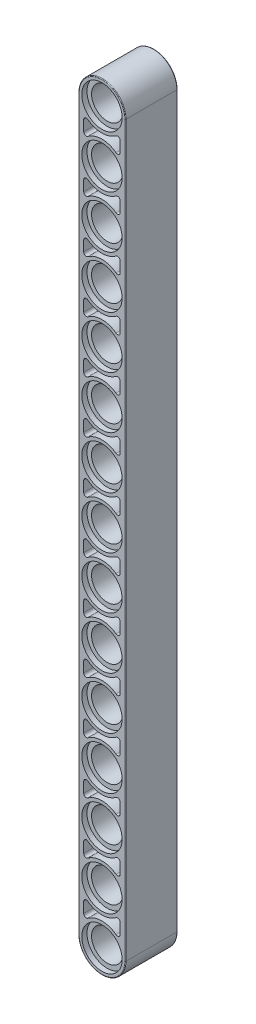
from build123d import *

# Parameters (mm, degrees)
BOSS_EXTRUDE1_DEPTH   = 8
CUT_EXTRUDE1_DEPTH    = 3.1
CUT_EXTRUDE2_DEPTH    = 3.1
CUT_EXTRUDE3_DEPTH    = 3.1
CUT_EXTRUDE4_DEPTH    = 3.1
CUT_EXTRUDE5_DEPTH    = 3.1
CUT_EXTRUDE6_DEPTH    = 3.1
CUT_EXTRUDE7_DEPTH    = 3.1
CUT_EXTRUDE8_DEPTH    = 3.1
CUT_EXTRUDE9_START    = -3.1
CUT_EXTRUDE9_DEPTH    = 3.1
CUT_EXTRUDE10_START   = -3.1
CUT_EXTRUDE10_DEPTH   = 3.1
CUT_EXTRUDE11_START   = -3.1
CUT_EXTRUDE11_DEPTH   = 3.1
CUT_EXTRUDE12_START   = -3.1
CUT_EXTRUDE12_DEPTH   = 3.1
CUT_EXTRUDE13_START   = -3.1
CUT_EXTRUDE13_DEPTH   = 3.1
CUT_EXTRUDE14_START   = -3.1
CUT_EXTRUDE14_DEPTH   = 3.1
CUT_EXTRUDE15_START   = -3.1
CUT_EXTRUDE15_DEPTH   = 3.1
CUT_EXTRUDE16_START   = -3.1
CUT_EXTRUDE16_DEPTH   = 3.1
FILLET1_R             = 0.1
LPATTERN1_COUNT       = 4
LPATTERN1_PITCH       = 8
LPATTERN1_COUNT_DIR2  = 12
LPATTERN1_PITCH_DIR2  = 8
LPATTERN2_COUNT       = 9
LPATTERN2_PITCH       = 8
LPATTERN2_COUNT_DIR2  = 6
LPATTERN2_PITCH_DIR2  = 8
MIRROR1_COPY_1_DEPTH  = 3.1
MIRROR1_COPY_2_DEPTH  = 3.1
MIRROR1_COPY_3_DEPTH  = 3.1
MIRROR1_COPY_4_DEPTH  = 3.1
MIRROR1_COPY_5_DEPTH  = 3.1
MIRROR1_COPY_6_DEPTH  = 3.1
MIRROR1_COPY_7_DEPTH  = 3.1
MIRROR1_COPY_8_DEPTH  = 3.1
MIRROR1_COPY_9_DEPTH  = 3.1
MIRROR1_COPY_10_DEPTH = 3.1
MIRROR1_COPY_11_DEPTH = 3.1
MIRROR1_COPY_12_DEPTH = 3.1
MIRROR1_COPY_13_DEPTH = 3.1
MIRROR1_COPY_14_DEPTH = 3.1
MIRROR1_COPY_15_DEPTH = 3.1
MIRROR1_COPY_16_DEPTH = 3.1
MIRROR1_COPY_17_DEPTH = 3.1
MIRROR1_COPY_18_DEPTH = 3.1
MIRROR1_COPY_19_DEPTH = 3.1
MIRROR1_COPY_20_DEPTH = 3.1
MIRROR1_COPY_21_DEPTH = 3.1
MIRROR1_COPY_22_DEPTH = 3.1
MIRROR1_COPY_23_DEPTH = 3.1
MIRROR1_COPY_24_DEPTH = 3.1
MIRROR1_COPY_25_DEPTH = 3.1
MIRROR1_COPY_26_DEPTH = 3.1
MIRROR1_COPY_27_DEPTH = 3.1
MIRROR1_COPY_28_DEPTH = 3.1
MIRROR1_COPY_29_DEPTH = 3.1
MIRROR1_COPY_30_DEPTH = 3.1
MIRROR1_COPY_31_DEPTH = 3.1
MIRROR1_COPY_32_DEPTH = 3.1
MIRROR1_COPY_33_DEPTH = 3.1
MIRROR1_COPY_34_DEPTH = 3.1
MIRROR1_COPY_35_DEPTH = 3.1
MIRROR1_COPY_36_DEPTH = 3.1
MIRROR1_COPY_37_DEPTH = 3.1
MIRROR1_COPY_38_DEPTH = 3.1
MIRROR1_COPY_39_DEPTH = 3.1
MIRROR1_COPY_40_DEPTH = 3.1
MIRROR1_COPY_41_DEPTH = 3.1
MIRROR1_COPY_42_DEPTH = 3.1
MIRROR1_COPY_43_DEPTH = 3.1
MIRROR1_COPY_44_DEPTH = 3.1
MIRROR1_COPY_45_DEPTH = 3.1
MIRROR1_COPY_46_DEPTH = 3.1
MIRROR1_COPY_47_DEPTH = 3.1
MIRROR1_COPY_48_DEPTH = 3.1
MIRROR1_COPY_49_DEPTH = 3.1
MIRROR1_COPY_50_DEPTH = 3.1
MIRROR1_COPY_51_DEPTH = 3.1
MIRROR1_COPY_52_DEPTH = 3.1
MIRROR1_COPY_53_DEPTH = 3.1
MIRROR1_COPY_54_DEPTH = 3.1


with BuildPart() as part:
    # Sketch1 → Boss-Extrude1 (new body)
    with BuildSketch(Plane.XY.offset(4)):
        with BuildLine():
            Line((3.6, -56), (3.6, 56))
            ThreePointArc((3.6, 56), (0, 59.6), (-3.6, 56))
            Line((-3.6, 56), (-3.6, -56))
            ThreePointArc((-3.6, -56), (0, -59.6), (3.6, -56))
        make_face()
    extrude(amount=-BOSS_EXTRUDE1_DEPTH)

    # Sketch2 → Cut-Extrude1 (cut)
    with BuildSketch(Plane.XY.offset(4)):
        with BuildLine():
            Line((-2.8, -27.2), (-2.8, -28.8))
            ThreePointArc((-2.8, -28.8), (-2.578885438, -29.157770876), (-2.16, -29.12))
            ThreePointArc((-2.16, -29.12), (0, -28.4), (2.16, -29.12))
            ThreePointArc((2.16, -29.12), (2.578885438, -29.157770876), (2.8, -28.8))
            Line((2.8, -28.8), (2.8, -27.2))
            ThreePointArc((2.8, -27.2), (2.578885438, -26.842229124), (2.16, -26.88))
            ThreePointArc((2.16, -26.88), (0, -27.6), (-2.16, -26.88))
            ThreePointArc((-2.16, -26.88), (-2.578885438, -26.842229124), (-2.8, -27.2))
        make_face()
    extrude(amount=-CUT_EXTRUDE1_DEPTH, mode=Mode.SUBTRACT)

    # Sketch3 → Cut-Extrude2 (cut)
    with BuildSketch(Plane.XY.offset(4)):
        with BuildLine():
            Line((-2.8, -11.2), (-2.8, -12.8))
            ThreePointArc((-2.8, -12.8), (-2.578885438, -13.157770876), (-2.16, -13.12))
            ThreePointArc((-2.16, -13.12), (0, -12.4), (2.16, -13.12))
            ThreePointArc((2.16, -13.12), (2.578885438, -13.157770876), (2.8, -12.8))
            Line((2.8, -12.8), (2.8, -11.2))
            ThreePointArc((2.8, -11.2), (2.578885438, -10.842229124), (2.16, -10.88))
            ThreePointArc((2.16, -10.88), (0, -11.6), (-2.16, -10.88))
            ThreePointArc((-2.16, -10.88), (-2.578885438, -10.842229124), (-2.8, -11.2))
        make_face()
    extrude(amount=-CUT_EXTRUDE2_DEPTH, mode=Mode.SUBTRACT)

    # Sketch4 → Cut-Extrude3 (cut)
    with BuildSketch(Plane.XY.offset(4)):
        with BuildLine():
            Line((-2.8, 4.8), (-2.8, 3.2))
            ThreePointArc((-2.8, 3.2), (-2.578885438, 2.842229124), (-2.16, 2.88))
            ThreePointArc((-2.16, 2.88), (0, 3.6), (2.16, 2.88))
            ThreePointArc((2.16, 2.88), (2.578885438, 2.842229124), (2.8, 3.2))
            Line((2.8, 3.2), (2.8, 4.8))
            ThreePointArc((2.8, 4.8), (2.578885438, 5.157770876), (2.16, 5.12))
            ThreePointArc((2.16, 5.12), (0, 4.4), (-2.16, 5.12))
            ThreePointArc((-2.16, 5.12), (-2.578885438, 5.157770876), (-2.8, 4.8))
        make_face()
    extrude(amount=-CUT_EXTRUDE3_DEPTH, mode=Mode.SUBTRACT)

    # Sketch5 → Cut-Extrude4 (cut)
    with BuildSketch(Plane.XY.offset(4)):
        with BuildLine():
            Line((-2.8, 20.8), (-2.8, 19.2))
            ThreePointArc((-2.8, 19.2), (-2.578885438, 18.842229124), (-2.16, 18.88))
            ThreePointArc((-2.16, 18.88), (0, 19.6), (2.16, 18.88))
            ThreePointArc((2.16, 18.88), (2.578885438, 18.842229124), (2.8, 19.2))
            Line((2.8, 19.2), (2.8, 20.8))
            ThreePointArc((2.8, 20.8), (2.578885438, 21.157770876), (2.16, 21.12))
            ThreePointArc((2.16, 21.12), (0, 20.4), (-2.16, 21.12))
            ThreePointArc((-2.16, 21.12), (-2.578885438, 21.157770876), (-2.8, 20.8))
        make_face()
    extrude(amount=-CUT_EXTRUDE4_DEPTH, mode=Mode.SUBTRACT)

    # Sketch6 → Cut-Extrude5 (cut)
    with BuildSketch(Plane.XY.offset(4)):
        with BuildLine():
            Line((2.8, 27.2), (2.8, 28.8))
            ThreePointArc((2.8, 28.8), (2.578885438, 29.157770876), (2.16, 29.12))
            ThreePointArc((2.16, 29.12), (0, 28.4), (-2.16, 29.12))
            ThreePointArc((-2.16, 29.12), (-2.578885438, 29.157770876), (-2.8, 28.8))
            Line((-2.8, 28.8), (-2.8, 27.2))
            ThreePointArc((-2.8, 27.2), (-2.578885438, 26.842229124), (-2.16, 26.88))
            ThreePointArc((-2.16, 26.88), (0, 27.6), (2.16, 26.88))
            ThreePointArc((2.16, 26.88), (2.578885438, 26.842229124), (2.8, 27.2))
        make_face()
    extrude(amount=-CUT_EXTRUDE5_DEPTH, mode=Mode.SUBTRACT)

    # Sketch7 → Cut-Extrude6 (cut)
    with BuildSketch(Plane.XY.offset(4)):
        with BuildLine():
            Line((-2.8, 12.8), (-2.8, 11.2))
            ThreePointArc((-2.8, 11.2), (-2.578885438, 10.842229124), (-2.16, 10.88))
            ThreePointArc((-2.16, 10.88), (0, 11.6), (2.16, 10.88))
            ThreePointArc((2.16, 10.88), (2.578885438, 10.842229124), (2.8, 11.2))
            Line((2.8, 11.2), (2.8, 12.8))
            ThreePointArc((2.8, 12.8), (2.578885438, 13.157770876), (2.16, 13.12))
            ThreePointArc((2.16, 13.12), (0, 12.4), (-2.16, 13.12))
            ThreePointArc((-2.16, 13.12), (-2.578885438, 13.157770876), (-2.8, 12.8))
        make_face()
    cut_extrude6 = extrude(amount=-CUT_EXTRUDE6_DEPTH, mode=Mode.SUBTRACT)

    # Sketch8 → Cut-Extrude7 (cut)
    with BuildSketch(Plane.XY.offset(4)):
        with BuildLine():
            Line((-2.8, -3.2), (-2.8, -4.8))
            ThreePointArc((-2.8, -4.8), (-2.578885438, -5.157770876), (-2.16, -5.12))
            ThreePointArc((-2.16, -5.12), (0, -4.4), (2.16, -5.12))
            ThreePointArc((2.16, -5.12), (2.578885438, -5.157770876), (2.8, -4.8))
            Line((2.8, -4.8), (2.8, -3.2))
            ThreePointArc((2.8, -3.2), (2.578885438, -2.842229124), (2.16, -2.88))
            ThreePointArc((2.16, -2.88), (0, -3.6), (-2.16, -2.88))
            ThreePointArc((-2.16, -2.88), (-2.578885438, -2.842229124), (-2.8, -3.2))
        make_face()
    extrude(amount=-CUT_EXTRUDE7_DEPTH, mode=Mode.SUBTRACT)

    # Sketch9 → Cut-Extrude8 (cut)
    with BuildSketch(Plane.XY.offset(4)):
        with BuildLine():
            Line((-2.8, -19.2), (-2.8, -20.8))
            ThreePointArc((-2.8, -20.8), (-2.578885438, -21.157770876), (-2.16, -21.12))
            ThreePointArc((-2.16, -21.12), (0, -20.4), (2.16, -21.12))
            ThreePointArc((2.16, -21.12), (2.578885438, -21.157770876), (2.8, -20.8))
            Line((2.8, -20.8), (2.8, -19.2))
            ThreePointArc((2.8, -19.2), (2.578885438, -18.842229124), (2.16, -18.88))
            ThreePointArc((2.16, -18.88), (0, -19.6), (-2.16, -18.88))
            ThreePointArc((-2.16, -18.88), (-2.578885438, -18.842229124), (-2.8, -19.2))
        make_face()
    extrude(amount=-CUT_EXTRUDE8_DEPTH, mode=Mode.SUBTRACT)

    # Sketch10 → Cut-Extrude9 (cut)
    with BuildSketch(Plane(origin=(0, 0, -4), x_dir=(-1, 0, 0), z_dir=(0, 0, -1)).offset(CUT_EXTRUDE9_START)):
        with BuildLine():
            Line((-2.8, -27.2), (-2.8, -28.8))
            ThreePointArc((-2.8, -28.8), (-2.578885438, -29.157770876), (-2.16, -29.12))
            ThreePointArc((-2.16, -29.12), (0, -28.4), (2.16, -29.12))
            ThreePointArc((2.16, -29.12), (2.578885438, -29.157770876), (2.8, -28.8))
            Line((2.8, -28.8), (2.8, -27.2))
            ThreePointArc((2.8, -27.2), (2.578885438, -26.842229124), (2.16, -26.88))
            ThreePointArc((2.16, -26.88), (0, -27.6), (-2.16, -26.88))
            ThreePointArc((-2.16, -26.88), (-2.578885438, -26.842229124), (-2.8, -27.2))
        make_face()
    extrude(amount=CUT_EXTRUDE9_DEPTH, mode=Mode.SUBTRACT)

    # Sketch11 → Cut-Extrude10 (cut)
    with BuildSketch(Plane(origin=(0, 0, -4), x_dir=(-1, 0, 0), z_dir=(0, 0, -1)).offset(CUT_EXTRUDE10_START)):
        with BuildLine():
            Line((-2.8, -19.2), (-2.8, -20.8))
            ThreePointArc((-2.8, -20.8), (-2.578885438, -21.157770876), (-2.16, -21.12))
            ThreePointArc((-2.16, -21.12), (0, -20.4), (2.16, -21.12))
            ThreePointArc((2.16, -21.12), (2.578885438, -21.157770876), (2.8, -20.8))
            Line((2.8, -20.8), (2.8, -19.2))
            ThreePointArc((2.8, -19.2), (2.578885438, -18.842229124), (2.16, -18.88))
            ThreePointArc((2.16, -18.88), (0, -19.6), (-2.16, -18.88))
            ThreePointArc((-2.16, -18.88), (-2.578885438, -18.842229124), (-2.8, -19.2))
        make_face()
    extrude(amount=CUT_EXTRUDE10_DEPTH, mode=Mode.SUBTRACT)

    # Sketch12 → Cut-Extrude11 (cut)
    with BuildSketch(Plane(origin=(0, 0, -4), x_dir=(-1, 0, 0), z_dir=(0, 0, -1)).offset(CUT_EXTRUDE11_START)):
        with BuildLine():
            Line((-2.8, -11.2), (-2.8, -12.8))
            ThreePointArc((-2.8, -12.8), (-2.578885438, -13.157770876), (-2.16, -13.12))
            ThreePointArc((-2.16, -13.12), (0, -12.4), (2.16, -13.12))
            ThreePointArc((2.16, -13.12), (2.578885438, -13.157770876), (2.8, -12.8))
            Line((2.8, -12.8), (2.8, -11.2))
            ThreePointArc((2.8, -11.2), (2.578885438, -10.842229124), (2.16, -10.88))
            ThreePointArc((2.16, -10.88), (0, -11.6), (-2.16, -10.88))
            ThreePointArc((-2.16, -10.88), (-2.578885438, -10.842229124), (-2.8, -11.2))
        make_face()
    extrude(amount=CUT_EXTRUDE11_DEPTH, mode=Mode.SUBTRACT)

    # Sketch13 → Cut-Extrude12 (cut)
    with BuildSketch(Plane(origin=(0, 0, -4), x_dir=(-1, 0, 0), z_dir=(0, 0, -1)).offset(CUT_EXTRUDE12_START)):
        with BuildLine():
            Line((-2.8, -3.2), (-2.8, -4.8))
            ThreePointArc((-2.8, -4.8), (-2.578885438, -5.157770876), (-2.16, -5.12))
            ThreePointArc((-2.16, -5.12), (0, -4.4), (2.16, -5.12))
            ThreePointArc((2.16, -5.12), (2.578885438, -5.157770876), (2.8, -4.8))
            Line((2.8, -4.8), (2.8, -3.2))
            ThreePointArc((2.8, -3.2), (2.578885438, -2.842229124), (2.16, -2.88))
            ThreePointArc((2.16, -2.88), (0, -3.6), (-2.16, -2.88))
            ThreePointArc((-2.16, -2.88), (-2.578885438, -2.842229124), (-2.8, -3.2))
        make_face()
    extrude(amount=CUT_EXTRUDE12_DEPTH, mode=Mode.SUBTRACT)

    # Sketch14 → Cut-Extrude13 (cut)
    with BuildSketch(Plane(origin=(0, 0, -4), x_dir=(-1, 0, 0), z_dir=(0, 0, -1)).offset(CUT_EXTRUDE13_START)):
        with BuildLine():
            Line((-2.8, 4.8), (-2.8, 3.2))
            ThreePointArc((-2.8, 3.2), (-2.578885438, 2.842229124), (-2.16, 2.88))
            ThreePointArc((-2.16, 2.88), (0, 3.6), (2.16, 2.88))
            ThreePointArc((2.16, 2.88), (2.578885438, 2.842229124), (2.8, 3.2))
            Line((2.8, 3.2), (2.8, 4.8))
            ThreePointArc((2.8, 4.8), (2.578885438, 5.157770876), (2.16, 5.12))
            ThreePointArc((2.16, 5.12), (0, 4.4), (-2.16, 5.12))
            ThreePointArc((-2.16, 5.12), (-2.578885438, 5.157770876), (-2.8, 4.8))
        make_face()
    extrude(amount=CUT_EXTRUDE13_DEPTH, mode=Mode.SUBTRACT)

    # Sketch15 → Cut-Extrude14 (cut)
    with BuildSketch(Plane(origin=(0, 0, -4), x_dir=(-1, 0, 0), z_dir=(0, 0, -1)).offset(CUT_EXTRUDE14_START)):
        with BuildLine():
            Line((-2.8, 12.8), (-2.8, 11.2))
            ThreePointArc((-2.8, 11.2), (-2.578885438, 10.842229124), (-2.16, 10.88))
            ThreePointArc((-2.16, 10.88), (0, 11.6), (2.16, 10.88))
            ThreePointArc((2.16, 10.88), (2.578885438, 10.842229124), (2.8, 11.2))
            Line((2.8, 11.2), (2.8, 12.8))
            ThreePointArc((2.8, 12.8), (2.578885438, 13.157770876), (2.16, 13.12))
            ThreePointArc((2.16, 13.12), (0, 12.4), (-2.16, 13.12))
            ThreePointArc((-2.16, 13.12), (-2.578885438, 13.157770876), (-2.8, 12.8))
        make_face()
    extrude(amount=CUT_EXTRUDE14_DEPTH, mode=Mode.SUBTRACT)

    # Sketch16 → Cut-Extrude15 (cut)
    with BuildSketch(Plane(origin=(0, 0, -4), x_dir=(-1, 0, 0), z_dir=(0, 0, -1)).offset(CUT_EXTRUDE15_START)):
        with BuildLine():
            Line((-2.8, 20.8), (-2.8, 19.2))
            ThreePointArc((-2.8, 19.2), (-2.578885438, 18.842229124), (-2.16, 18.88))
            ThreePointArc((-2.16, 18.88), (0, 19.6), (2.16, 18.88))
            ThreePointArc((2.16, 18.88), (2.578885438, 18.842229124), (2.8, 19.2))
            Line((2.8, 19.2), (2.8, 20.8))
            ThreePointArc((2.8, 20.8), (2.578885438, 21.157770876), (2.16, 21.12))
            ThreePointArc((2.16, 21.12), (0, 20.4), (-2.16, 21.12))
            ThreePointArc((-2.16, 21.12), (-2.578885438, 21.157770876), (-2.8, 20.8))
        make_face()
    extrude(amount=CUT_EXTRUDE15_DEPTH, mode=Mode.SUBTRACT)

    # Sketch17 → Cut-Extrude16 (cut)
    with BuildSketch(Plane(origin=(0, 0, -4), x_dir=(-1, 0, 0), z_dir=(0, 0, -1)).offset(CUT_EXTRUDE16_START)):
        with BuildLine():
            Line((-2.8, 28.8), (-2.8, 27.2))
            ThreePointArc((-2.8, 27.2), (-2.578885438, 26.842229124), (-2.16, 26.88))
            ThreePointArc((-2.16, 26.88), (0, 27.6), (2.16, 26.88))
            ThreePointArc((2.16, 26.88), (2.578885438, 26.842229124), (2.8, 27.2))
            Line((2.8, 27.2), (2.8, 28.8))
            ThreePointArc((2.8, 28.8), (2.578885438, 29.157770876), (2.16, 29.12))
            ThreePointArc((2.16, 29.12), (0, 28.4), (-2.16, 29.12))
            ThreePointArc((-2.16, 29.12), (-2.578885438, 29.157770876), (-2.8, 28.8))
        make_face()
    extrude(amount=CUT_EXTRUDE16_DEPTH, mode=Mode.SUBTRACT)

    # Sketch18 → Cut-Revolve1 (revolve, cut)
    with BuildSketch(Plane(origin=(0, -32, 0), x_dir=(1, 0, 0), z_dir=(0, 1, 0))):
        Polygon((3.1, 4), (0, 4), (0, -4), (3.1, -4), (3.1, -3.2), (2.4, -3.2), (2.4, 3.2), (3.1, 3.2), align=None)
    revolve(axis=Axis((0, -32, -4), (0, 0, 1)), mode=Mode.SUBTRACT)

    # Sketch19 → Cut-Revolve2 (revolve, cut)
    with BuildSketch(Plane(origin=(0, -24, 0), x_dir=(1, 0, 0), z_dir=(0, 1, 0))):
        Polygon((3.1, 4), (0, 4), (0, -4), (3.1, -4), (3.1, -3.2), (2.4, -3.2), (2.4, 3.2), (3.1, 3.2), align=None)
    revolve(axis=Axis((0, -24, -4), (0, 0, 1)), mode=Mode.SUBTRACT)

    # Sketch20 → Cut-Revolve3 (revolve, cut)
    with BuildSketch(Plane(origin=(0, -16, 0), x_dir=(1, 0, 0), z_dir=(0, 1, 0))):
        Polygon((3.1, 4), (0, 4), (0, -4), (3.1, -4), (3.1, -3.2), (2.4, -3.2), (2.4, 3.2), (3.1, 3.2), align=None)
    revolve(axis=Axis((0, -16, -4), (0, 0, 1)), mode=Mode.SUBTRACT)

    # Sketch21 → Cut-Revolve4 (revolve, cut)
    with BuildSketch(Plane(origin=(0, -8, 0), x_dir=(1, 0, 0), z_dir=(0, 1, 0))):
        Polygon((3.1, 4), (0, 4), (0, -4), (3.1, -4), (3.1, -3.2), (2.4, -3.2), (2.4, 3.2), (3.1, 3.2), align=None)
    revolve(axis=Axis((0, -8, -4), (0, 0, 1)), mode=Mode.SUBTRACT)

    # Sketch22 → Cut-Revolve5 (revolve, cut)
    with BuildSketch(Plane(origin=(0, 0, 0), x_dir=(1, 0, 0), z_dir=(0, 1, 0))):
        Polygon((3.1, 4), (0, 4), (0, -4), (3.1, -4), (3.1, -3.2), (2.4, -3.2), (2.4, 3.2), (3.1, 3.2), align=None)
    revolve(axis=Axis((0, 0, -4), (0, 0, 1)), mode=Mode.SUBTRACT)

    # Sketch23 → Cut-Revolve6 (revolve, cut)
    with BuildSketch(Plane(origin=(0, 8, 0), x_dir=(1, 0, 0), z_dir=(0, 1, 0))):
        Polygon((3.1, 4), (0, 4), (0, -4), (3.1, -4), (3.1, -3.2), (2.4, -3.2), (2.4, 3.2), (3.1, 3.2), align=None)
    revolve(axis=Axis((0, 8, -4), (0, 0, 1)), mode=Mode.SUBTRACT)

    # Sketch24 → Cut-Revolve7 (revolve, cut)
    with BuildSketch(Plane(origin=(0, 16, 0), x_dir=(1, 0, 0), z_dir=(0, 1, 0))):
        Polygon((3.1, 4), (0, 4), (0, -4), (3.1, -4), (3.1, -3.2), (2.4, -3.2), (2.4, 3.2), (3.1, 3.2), align=None)
    revolve(axis=Axis((0, 16, -4), (0, 0, 1)), mode=Mode.SUBTRACT)

    # Sketch25 → Cut-Revolve8 (revolve, cut)
    with BuildSketch(Plane(origin=(0, 24, 0), x_dir=(1, 0, 0), z_dir=(0, 1, 0))):
        Polygon((3.1, 4), (0, 4), (0, -4), (3.1, -4), (3.1, -3.2), (2.4, -3.2), (2.4, 3.2), (3.1, 3.2), align=None)
    revolve(axis=Axis((0, 24, -4), (0, 0, 1)), mode=Mode.SUBTRACT)

    # Sketch26 → Cut-Revolve9 (revolve, cut)
    with BuildSketch(Plane(origin=(0, 32, 0), x_dir=(1, 0, 0), z_dir=(0, 1, 0))):
        Polygon((3.1, 4), (0, 4), (0, -4), (3.1, -4), (3.1, -3.2), (2.4, -3.2), (2.4, 3.2), (3.1, 3.2), align=None)
    cut_revolve9 = revolve(axis=Axis((0, 32, -4), (0, 0, 1)), mode=Mode.SUBTRACT)

    # Fillet1
    fillet1_edges = [part.edges().sort_by_distance(p)[0] for p in [
        (0, 59.6, -4),
        (3.6, 0, -4),
        (-3.6, 0, -4),
        (0, -59.6, -4),
        (-3.6, 0, 4),
        (0, 59.6, 4),
        (0, -59.6, 4),
        (3.6, 0, 4),
    ]]
    fillet(fillet1_edges, radius=FILLET1_R)

    # LPattern1: Cut-Revolve9 4 × 12
    with Locations(*[Vector(0, 1, 0) * (i * LPATTERN1_PITCH) + Vector(0, -1, 0) * (j * LPATTERN1_PITCH_DIR2) for i in range(LPATTERN1_COUNT) for j in range(LPATTERN1_COUNT_DIR2) if (i, j) != (0, 0)]):
        add(cut_revolve9, mode=Mode.SUBTRACT)

    # LPattern2: Cut-Extrude6 9 × 6
    with Locations(*[Vector(0, -1, 0) * (i * LPATTERN2_PITCH) + Vector(0, 1, 0) * (j * LPATTERN2_PITCH_DIR2) for i in range(LPATTERN2_COUNT) for j in range(LPATTERN2_COUNT_DIR2) if (i, j) != (0, 0)]):
        add(cut_extrude6, mode=Mode.SUBTRACT)

    # Mirror1 copy 1 sketch → Mirror1 copy 1 (cut)
    with BuildSketch(Plane(origin=(0, 8, -4), x_dir=(1, 0, 0), z_dir=(0, 0, -1))):
        with BuildLine():
            Line((-2.8, -12.8), (-2.8, -11.2))
            ThreePointArc((-2.8, -11.2), (-2.578885438, -10.842229124), (-2.16, -10.88))
            ThreePointArc((-2.16, -10.88), (0, -11.6), (2.16, -10.88))
            ThreePointArc((2.16, -10.88), (2.578885438, -10.842229124), (2.8, -11.2))
            Line((2.8, -11.2), (2.8, -12.8))
            ThreePointArc((2.8, -12.8), (2.578885438, -13.157770876), (2.16, -13.12))
            ThreePointArc((2.16, -13.12), (0, -12.4), (-2.16, -13.12))
            ThreePointArc((-2.16, -13.12), (-2.578885438, -13.157770876), (-2.8, -12.8))
        make_face()
    extrude(amount=-MIRROR1_COPY_1_DEPTH, mode=Mode.SUBTRACT)

    # Mirror1 copy 2 sketch → Mirror1 copy 2 (cut)
    with BuildSketch(Plane(origin=(0, 16, -4), x_dir=(1, 0, 0), z_dir=(0, 0, -1))):
        with BuildLine():
            Line((-2.8, -12.8), (-2.8, -11.2))
            ThreePointArc((-2.8, -11.2), (-2.578885438, -10.842229124), (-2.16, -10.88))
            ThreePointArc((-2.16, -10.88), (0, -11.6), (2.16, -10.88))
            ThreePointArc((2.16, -10.88), (2.578885438, -10.842229124), (2.8, -11.2))
            Line((2.8, -11.2), (2.8, -12.8))
            ThreePointArc((2.8, -12.8), (2.578885438, -13.157770876), (2.16, -13.12))
            ThreePointArc((2.16, -13.12), (0, -12.4), (-2.16, -13.12))
            ThreePointArc((-2.16, -13.12), (-2.578885438, -13.157770876), (-2.8, -12.8))
        make_face()
    extrude(amount=-MIRROR1_COPY_2_DEPTH, mode=Mode.SUBTRACT)

    # Mirror1 copy 3 sketch → Mirror1 copy 3 (cut)
    with BuildSketch(Plane(origin=(0, 24, -4), x_dir=(1, 0, 0), z_dir=(0, 0, -1))):
        with BuildLine():
            Line((-2.8, -12.8), (-2.8, -11.2))
            ThreePointArc((-2.8, -11.2), (-2.578885438, -10.842229124), (-2.16, -10.88))
            ThreePointArc((-2.16, -10.88), (0, -11.6), (2.16, -10.88))
            ThreePointArc((2.16, -10.88), (2.578885438, -10.842229124), (2.8, -11.2))
            Line((2.8, -11.2), (2.8, -12.8))
            ThreePointArc((2.8, -12.8), (2.578885438, -13.157770876), (2.16, -13.12))
            ThreePointArc((2.16, -13.12), (0, -12.4), (-2.16, -13.12))
            ThreePointArc((-2.16, -13.12), (-2.578885438, -13.157770876), (-2.8, -12.8))
        make_face()
    extrude(amount=-MIRROR1_COPY_3_DEPTH, mode=Mode.SUBTRACT)

    # Mirror1 copy 4 sketch → Mirror1 copy 4 (cut)
    with BuildSketch(Plane(origin=(0, 32, -4), x_dir=(1, 0, 0), z_dir=(0, 0, -1))):
        with BuildLine():
            Line((-2.8, -12.8), (-2.8, -11.2))
            ThreePointArc((-2.8, -11.2), (-2.578885438, -10.842229124), (-2.16, -10.88))
            ThreePointArc((-2.16, -10.88), (0, -11.6), (2.16, -10.88))
            ThreePointArc((2.16, -10.88), (2.578885438, -10.842229124), (2.8, -11.2))
            Line((2.8, -11.2), (2.8, -12.8))
            ThreePointArc((2.8, -12.8), (2.578885438, -13.157770876), (2.16, -13.12))
            ThreePointArc((2.16, -13.12), (0, -12.4), (-2.16, -13.12))
            ThreePointArc((-2.16, -13.12), (-2.578885438, -13.157770876), (-2.8, -12.8))
        make_face()
    extrude(amount=-MIRROR1_COPY_4_DEPTH, mode=Mode.SUBTRACT)

    # Mirror1 copy 5 sketch → Mirror1 copy 5 (cut)
    with BuildSketch(Plane(origin=(0, 40, -4), x_dir=(1, 0, 0), z_dir=(0, 0, -1))):
        with BuildLine():
            Line((-2.8, -12.8), (-2.8, -11.2))
            ThreePointArc((-2.8, -11.2), (-2.578885438, -10.842229124), (-2.16, -10.88))
            ThreePointArc((-2.16, -10.88), (0, -11.6), (2.16, -10.88))
            ThreePointArc((2.16, -10.88), (2.578885438, -10.842229124), (2.8, -11.2))
            Line((2.8, -11.2), (2.8, -12.8))
            ThreePointArc((2.8, -12.8), (2.578885438, -13.157770876), (2.16, -13.12))
            ThreePointArc((2.16, -13.12), (0, -12.4), (-2.16, -13.12))
            ThreePointArc((-2.16, -13.12), (-2.578885438, -13.157770876), (-2.8, -12.8))
        make_face()
    extrude(amount=-MIRROR1_COPY_5_DEPTH, mode=Mode.SUBTRACT)

    # Mirror1 copy 6 sketch → Mirror1 copy 6 (cut)
    with BuildSketch(Plane(origin=(0, -8, -4), x_dir=(1, 0, 0), z_dir=(0, 0, -1))):
        with BuildLine():
            Line((-2.8, -12.8), (-2.8, -11.2))
            ThreePointArc((-2.8, -11.2), (-2.578885438, -10.842229124), (-2.16, -10.88))
            ThreePointArc((-2.16, -10.88), (0, -11.6), (2.16, -10.88))
            ThreePointArc((2.16, -10.88), (2.578885438, -10.842229124), (2.8, -11.2))
            Line((2.8, -11.2), (2.8, -12.8))
            ThreePointArc((2.8, -12.8), (2.578885438, -13.157770876), (2.16, -13.12))
            ThreePointArc((2.16, -13.12), (0, -12.4), (-2.16, -13.12))
            ThreePointArc((-2.16, -13.12), (-2.578885438, -13.157770876), (-2.8, -12.8))
        make_face()
    extrude(amount=-MIRROR1_COPY_6_DEPTH, mode=Mode.SUBTRACT)

    # Mirror1 copy 7 sketch → Mirror1 copy 7 (cut)
    with BuildSketch(Plane(origin=(0, 0, -4), x_dir=(1, 0, 0), z_dir=(0, 0, -1))):
        with BuildLine():
            Line((-2.8, -12.8), (-2.8, -11.2))
            ThreePointArc((-2.8, -11.2), (-2.578885438, -10.842229124), (-2.16, -10.88))
            ThreePointArc((-2.16, -10.88), (0, -11.6), (2.16, -10.88))
            ThreePointArc((2.16, -10.88), (2.578885438, -10.842229124), (2.8, -11.2))
            Line((2.8, -11.2), (2.8, -12.8))
            ThreePointArc((2.8, -12.8), (2.578885438, -13.157770876), (2.16, -13.12))
            ThreePointArc((2.16, -13.12), (0, -12.4), (-2.16, -13.12))
            ThreePointArc((-2.16, -13.12), (-2.578885438, -13.157770876), (-2.8, -12.8))
        make_face()
    extrude(amount=-MIRROR1_COPY_7_DEPTH, mode=Mode.SUBTRACT)

    # Mirror1 copy 8 sketch → Mirror1 copy 8 (cut)
    with BuildSketch(Plane(origin=(0, 8, -4), x_dir=(1, 0, 0), z_dir=(0, 0, -1))):
        with BuildLine():
            Line((-2.8, -12.8), (-2.8, -11.2))
            ThreePointArc((-2.8, -11.2), (-2.578885438, -10.842229124), (-2.16, -10.88))
            ThreePointArc((-2.16, -10.88), (0, -11.6), (2.16, -10.88))
            ThreePointArc((2.16, -10.88), (2.578885438, -10.842229124), (2.8, -11.2))
            Line((2.8, -11.2), (2.8, -12.8))
            ThreePointArc((2.8, -12.8), (2.578885438, -13.157770876), (2.16, -13.12))
            ThreePointArc((2.16, -13.12), (0, -12.4), (-2.16, -13.12))
            ThreePointArc((-2.16, -13.12), (-2.578885438, -13.157770876), (-2.8, -12.8))
        make_face()
    extrude(amount=-MIRROR1_COPY_8_DEPTH, mode=Mode.SUBTRACT)

    # Mirror1 copy 9 sketch → Mirror1 copy 9 (cut)
    with BuildSketch(Plane(origin=(0, 16, -4), x_dir=(1, 0, 0), z_dir=(0, 0, -1))):
        with BuildLine():
            Line((-2.8, -12.8), (-2.8, -11.2))
            ThreePointArc((-2.8, -11.2), (-2.578885438, -10.842229124), (-2.16, -10.88))
            ThreePointArc((-2.16, -10.88), (0, -11.6), (2.16, -10.88))
            ThreePointArc((2.16, -10.88), (2.578885438, -10.842229124), (2.8, -11.2))
            Line((2.8, -11.2), (2.8, -12.8))
            ThreePointArc((2.8, -12.8), (2.578885438, -13.157770876), (2.16, -13.12))
            ThreePointArc((2.16, -13.12), (0, -12.4), (-2.16, -13.12))
            ThreePointArc((-2.16, -13.12), (-2.578885438, -13.157770876), (-2.8, -12.8))
        make_face()
    extrude(amount=-MIRROR1_COPY_9_DEPTH, mode=Mode.SUBTRACT)

    # Mirror1 copy 10 sketch → Mirror1 copy 10 (cut)
    with BuildSketch(Plane(origin=(0, 24, -4), x_dir=(1, 0, 0), z_dir=(0, 0, -1))):
        with BuildLine():
            Line((-2.8, -12.8), (-2.8, -11.2))
            ThreePointArc((-2.8, -11.2), (-2.578885438, -10.842229124), (-2.16, -10.88))
            ThreePointArc((-2.16, -10.88), (0, -11.6), (2.16, -10.88))
            ThreePointArc((2.16, -10.88), (2.578885438, -10.842229124), (2.8, -11.2))
            Line((2.8, -11.2), (2.8, -12.8))
            ThreePointArc((2.8, -12.8), (2.578885438, -13.157770876), (2.16, -13.12))
            ThreePointArc((2.16, -13.12), (0, -12.4), (-2.16, -13.12))
            ThreePointArc((-2.16, -13.12), (-2.578885438, -13.157770876), (-2.8, -12.8))
        make_face()
    extrude(amount=-MIRROR1_COPY_10_DEPTH, mode=Mode.SUBTRACT)

    # Mirror1 copy 11 sketch → Mirror1 copy 11 (cut)
    with BuildSketch(Plane(origin=(0, 32, -4), x_dir=(1, 0, 0), z_dir=(0, 0, -1))):
        with BuildLine():
            Line((-2.8, -12.8), (-2.8, -11.2))
            ThreePointArc((-2.8, -11.2), (-2.578885438, -10.842229124), (-2.16, -10.88))
            ThreePointArc((-2.16, -10.88), (0, -11.6), (2.16, -10.88))
            ThreePointArc((2.16, -10.88), (2.578885438, -10.842229124), (2.8, -11.2))
            Line((2.8, -11.2), (2.8, -12.8))
            ThreePointArc((2.8, -12.8), (2.578885438, -13.157770876), (2.16, -13.12))
            ThreePointArc((2.16, -13.12), (0, -12.4), (-2.16, -13.12))
            ThreePointArc((-2.16, -13.12), (-2.578885438, -13.157770876), (-2.8, -12.8))
        make_face()
    extrude(amount=-MIRROR1_COPY_11_DEPTH, mode=Mode.SUBTRACT)

    # Mirror1 copy 12 sketch → Mirror1 copy 12 (cut)
    with BuildSketch(Plane(origin=(0, -16, -4), x_dir=(1, 0, 0), z_dir=(0, 0, -1))):
        with BuildLine():
            Line((-2.8, -12.8), (-2.8, -11.2))
            ThreePointArc((-2.8, -11.2), (-2.578885438, -10.842229124), (-2.16, -10.88))
            ThreePointArc((-2.16, -10.88), (0, -11.6), (2.16, -10.88))
            ThreePointArc((2.16, -10.88), (2.578885438, -10.842229124), (2.8, -11.2))
            Line((2.8, -11.2), (2.8, -12.8))
            ThreePointArc((2.8, -12.8), (2.578885438, -13.157770876), (2.16, -13.12))
            ThreePointArc((2.16, -13.12), (0, -12.4), (-2.16, -13.12))
            ThreePointArc((-2.16, -13.12), (-2.578885438, -13.157770876), (-2.8, -12.8))
        make_face()
    extrude(amount=-MIRROR1_COPY_12_DEPTH, mode=Mode.SUBTRACT)

    # Mirror1 copy 13 sketch → Mirror1 copy 13 (cut)
    with BuildSketch(Plane(origin=(0, -8, -4), x_dir=(1, 0, 0), z_dir=(0, 0, -1))):
        with BuildLine():
            Line((-2.8, -12.8), (-2.8, -11.2))
            ThreePointArc((-2.8, -11.2), (-2.578885438, -10.842229124), (-2.16, -10.88))
            ThreePointArc((-2.16, -10.88), (0, -11.6), (2.16, -10.88))
            ThreePointArc((2.16, -10.88), (2.578885438, -10.842229124), (2.8, -11.2))
            Line((2.8, -11.2), (2.8, -12.8))
            ThreePointArc((2.8, -12.8), (2.578885438, -13.157770876), (2.16, -13.12))
            ThreePointArc((2.16, -13.12), (0, -12.4), (-2.16, -13.12))
            ThreePointArc((-2.16, -13.12), (-2.578885438, -13.157770876), (-2.8, -12.8))
        make_face()
    extrude(amount=-MIRROR1_COPY_13_DEPTH, mode=Mode.SUBTRACT)

    # Mirror1 copy 14 sketch → Mirror1 copy 14 (cut)
    with BuildSketch(Plane(origin=(0, 0, -4), x_dir=(1, 0, 0), z_dir=(0, 0, -1))):
        with BuildLine():
            Line((-2.8, -12.8), (-2.8, -11.2))
            ThreePointArc((-2.8, -11.2), (-2.578885438, -10.842229124), (-2.16, -10.88))
            ThreePointArc((-2.16, -10.88), (0, -11.6), (2.16, -10.88))
            ThreePointArc((2.16, -10.88), (2.578885438, -10.842229124), (2.8, -11.2))
            Line((2.8, -11.2), (2.8, -12.8))
            ThreePointArc((2.8, -12.8), (2.578885438, -13.157770876), (2.16, -13.12))
            ThreePointArc((2.16, -13.12), (0, -12.4), (-2.16, -13.12))
            ThreePointArc((-2.16, -13.12), (-2.578885438, -13.157770876), (-2.8, -12.8))
        make_face()
    extrude(amount=-MIRROR1_COPY_14_DEPTH, mode=Mode.SUBTRACT)

    # Mirror1 copy 15 sketch → Mirror1 copy 15 (cut)
    with BuildSketch(Plane(origin=(0, 8, -4), x_dir=(1, 0, 0), z_dir=(0, 0, -1))):
        with BuildLine():
            Line((-2.8, -12.8), (-2.8, -11.2))
            ThreePointArc((-2.8, -11.2), (-2.578885438, -10.842229124), (-2.16, -10.88))
            ThreePointArc((-2.16, -10.88), (0, -11.6), (2.16, -10.88))
            ThreePointArc((2.16, -10.88), (2.578885438, -10.842229124), (2.8, -11.2))
            Line((2.8, -11.2), (2.8, -12.8))
            ThreePointArc((2.8, -12.8), (2.578885438, -13.157770876), (2.16, -13.12))
            ThreePointArc((2.16, -13.12), (0, -12.4), (-2.16, -13.12))
            ThreePointArc((-2.16, -13.12), (-2.578885438, -13.157770876), (-2.8, -12.8))
        make_face()
    extrude(amount=-MIRROR1_COPY_15_DEPTH, mode=Mode.SUBTRACT)

    # Mirror1 copy 16 sketch → Mirror1 copy 16 (cut)
    with BuildSketch(Plane(origin=(0, 16, -4), x_dir=(1, 0, 0), z_dir=(0, 0, -1))):
        with BuildLine():
            Line((-2.8, -12.8), (-2.8, -11.2))
            ThreePointArc((-2.8, -11.2), (-2.578885438, -10.842229124), (-2.16, -10.88))
            ThreePointArc((-2.16, -10.88), (0, -11.6), (2.16, -10.88))
            ThreePointArc((2.16, -10.88), (2.578885438, -10.842229124), (2.8, -11.2))
            Line((2.8, -11.2), (2.8, -12.8))
            ThreePointArc((2.8, -12.8), (2.578885438, -13.157770876), (2.16, -13.12))
            ThreePointArc((2.16, -13.12), (0, -12.4), (-2.16, -13.12))
            ThreePointArc((-2.16, -13.12), (-2.578885438, -13.157770876), (-2.8, -12.8))
        make_face()
    extrude(amount=-MIRROR1_COPY_16_DEPTH, mode=Mode.SUBTRACT)

    # Mirror1 copy 17 sketch → Mirror1 copy 17 (cut)
    with BuildSketch(Plane(origin=(0, 24, -4), x_dir=(1, 0, 0), z_dir=(0, 0, -1))):
        with BuildLine():
            Line((-2.8, -12.8), (-2.8, -11.2))
            ThreePointArc((-2.8, -11.2), (-2.578885438, -10.842229124), (-2.16, -10.88))
            ThreePointArc((-2.16, -10.88), (0, -11.6), (2.16, -10.88))
            ThreePointArc((2.16, -10.88), (2.578885438, -10.842229124), (2.8, -11.2))
            Line((2.8, -11.2), (2.8, -12.8))
            ThreePointArc((2.8, -12.8), (2.578885438, -13.157770876), (2.16, -13.12))
            ThreePointArc((2.16, -13.12), (0, -12.4), (-2.16, -13.12))
            ThreePointArc((-2.16, -13.12), (-2.578885438, -13.157770876), (-2.8, -12.8))
        make_face()
    extrude(amount=-MIRROR1_COPY_17_DEPTH, mode=Mode.SUBTRACT)

    # Mirror1 copy 18 sketch → Mirror1 copy 18 (cut)
    with BuildSketch(Plane(origin=(0, -24, -4), x_dir=(1, 0, 0), z_dir=(0, 0, -1))):
        with BuildLine():
            Line((-2.8, -12.8), (-2.8, -11.2))
            ThreePointArc((-2.8, -11.2), (-2.578885438, -10.842229124), (-2.16, -10.88))
            ThreePointArc((-2.16, -10.88), (0, -11.6), (2.16, -10.88))
            ThreePointArc((2.16, -10.88), (2.578885438, -10.842229124), (2.8, -11.2))
            Line((2.8, -11.2), (2.8, -12.8))
            ThreePointArc((2.8, -12.8), (2.578885438, -13.157770876), (2.16, -13.12))
            ThreePointArc((2.16, -13.12), (0, -12.4), (-2.16, -13.12))
            ThreePointArc((-2.16, -13.12), (-2.578885438, -13.157770876), (-2.8, -12.8))
        make_face()
    extrude(amount=-MIRROR1_COPY_18_DEPTH, mode=Mode.SUBTRACT)

    # Mirror1 copy 19 sketch → Mirror1 copy 19 (cut)
    with BuildSketch(Plane(origin=(0, -16, -4), x_dir=(1, 0, 0), z_dir=(0, 0, -1))):
        with BuildLine():
            Line((-2.8, -12.8), (-2.8, -11.2))
            ThreePointArc((-2.8, -11.2), (-2.578885438, -10.842229124), (-2.16, -10.88))
            ThreePointArc((-2.16, -10.88), (0, -11.6), (2.16, -10.88))
            ThreePointArc((2.16, -10.88), (2.578885438, -10.842229124), (2.8, -11.2))
            Line((2.8, -11.2), (2.8, -12.8))
            ThreePointArc((2.8, -12.8), (2.578885438, -13.157770876), (2.16, -13.12))
            ThreePointArc((2.16, -13.12), (0, -12.4), (-2.16, -13.12))
            ThreePointArc((-2.16, -13.12), (-2.578885438, -13.157770876), (-2.8, -12.8))
        make_face()
    extrude(amount=-MIRROR1_COPY_19_DEPTH, mode=Mode.SUBTRACT)

    # Mirror1 copy 20 sketch → Mirror1 copy 20 (cut)
    with BuildSketch(Plane(origin=(0, -8, -4), x_dir=(1, 0, 0), z_dir=(0, 0, -1))):
        with BuildLine():
            Line((-2.8, -12.8), (-2.8, -11.2))
            ThreePointArc((-2.8, -11.2), (-2.578885438, -10.842229124), (-2.16, -10.88))
            ThreePointArc((-2.16, -10.88), (0, -11.6), (2.16, -10.88))
            ThreePointArc((2.16, -10.88), (2.578885438, -10.842229124), (2.8, -11.2))
            Line((2.8, -11.2), (2.8, -12.8))
            ThreePointArc((2.8, -12.8), (2.578885438, -13.157770876), (2.16, -13.12))
            ThreePointArc((2.16, -13.12), (0, -12.4), (-2.16, -13.12))
            ThreePointArc((-2.16, -13.12), (-2.578885438, -13.157770876), (-2.8, -12.8))
        make_face()
    extrude(amount=-MIRROR1_COPY_20_DEPTH, mode=Mode.SUBTRACT)

    # Mirror1 copy 21 sketch → Mirror1 copy 21 (cut)
    with BuildSketch(Plane(origin=(0, 0, -4), x_dir=(1, 0, 0), z_dir=(0, 0, -1))):
        with BuildLine():
            Line((-2.8, -12.8), (-2.8, -11.2))
            ThreePointArc((-2.8, -11.2), (-2.578885438, -10.842229124), (-2.16, -10.88))
            ThreePointArc((-2.16, -10.88), (0, -11.6), (2.16, -10.88))
            ThreePointArc((2.16, -10.88), (2.578885438, -10.842229124), (2.8, -11.2))
            Line((2.8, -11.2), (2.8, -12.8))
            ThreePointArc((2.8, -12.8), (2.578885438, -13.157770876), (2.16, -13.12))
            ThreePointArc((2.16, -13.12), (0, -12.4), (-2.16, -13.12))
            ThreePointArc((-2.16, -13.12), (-2.578885438, -13.157770876), (-2.8, -12.8))
        make_face()
    extrude(amount=-MIRROR1_COPY_21_DEPTH, mode=Mode.SUBTRACT)

    # Mirror1 copy 22 sketch → Mirror1 copy 22 (cut)
    with BuildSketch(Plane(origin=(0, 8, -4), x_dir=(1, 0, 0), z_dir=(0, 0, -1))):
        with BuildLine():
            Line((-2.8, -12.8), (-2.8, -11.2))
            ThreePointArc((-2.8, -11.2), (-2.578885438, -10.842229124), (-2.16, -10.88))
            ThreePointArc((-2.16, -10.88), (0, -11.6), (2.16, -10.88))
            ThreePointArc((2.16, -10.88), (2.578885438, -10.842229124), (2.8, -11.2))
            Line((2.8, -11.2), (2.8, -12.8))
            ThreePointArc((2.8, -12.8), (2.578885438, -13.157770876), (2.16, -13.12))
            ThreePointArc((2.16, -13.12), (0, -12.4), (-2.16, -13.12))
            ThreePointArc((-2.16, -13.12), (-2.578885438, -13.157770876), (-2.8, -12.8))
        make_face()
    extrude(amount=-MIRROR1_COPY_22_DEPTH, mode=Mode.SUBTRACT)

    # Mirror1 copy 23 sketch → Mirror1 copy 23 (cut)
    with BuildSketch(Plane(origin=(0, 16, -4), x_dir=(1, 0, 0), z_dir=(0, 0, -1))):
        with BuildLine():
            Line((-2.8, -12.8), (-2.8, -11.2))
            ThreePointArc((-2.8, -11.2), (-2.578885438, -10.842229124), (-2.16, -10.88))
            ThreePointArc((-2.16, -10.88), (0, -11.6), (2.16, -10.88))
            ThreePointArc((2.16, -10.88), (2.578885438, -10.842229124), (2.8, -11.2))
            Line((2.8, -11.2), (2.8, -12.8))
            ThreePointArc((2.8, -12.8), (2.578885438, -13.157770876), (2.16, -13.12))
            ThreePointArc((2.16, -13.12), (0, -12.4), (-2.16, -13.12))
            ThreePointArc((-2.16, -13.12), (-2.578885438, -13.157770876), (-2.8, -12.8))
        make_face()
    extrude(amount=-MIRROR1_COPY_23_DEPTH, mode=Mode.SUBTRACT)

    # Mirror1 copy 24 sketch → Mirror1 copy 24 (cut)
    with BuildSketch(Plane(origin=(0, -32, -4), x_dir=(1, 0, 0), z_dir=(0, 0, -1))):
        with BuildLine():
            Line((-2.8, -12.8), (-2.8, -11.2))
            ThreePointArc((-2.8, -11.2), (-2.578885438, -10.842229124), (-2.16, -10.88))
            ThreePointArc((-2.16, -10.88), (0, -11.6), (2.16, -10.88))
            ThreePointArc((2.16, -10.88), (2.578885438, -10.842229124), (2.8, -11.2))
            Line((2.8, -11.2), (2.8, -12.8))
            ThreePointArc((2.8, -12.8), (2.578885438, -13.157770876), (2.16, -13.12))
            ThreePointArc((2.16, -13.12), (0, -12.4), (-2.16, -13.12))
            ThreePointArc((-2.16, -13.12), (-2.578885438, -13.157770876), (-2.8, -12.8))
        make_face()
    extrude(amount=-MIRROR1_COPY_24_DEPTH, mode=Mode.SUBTRACT)

    # Mirror1 copy 25 sketch → Mirror1 copy 25 (cut)
    with BuildSketch(Plane(origin=(0, -24, -4), x_dir=(1, 0, 0), z_dir=(0, 0, -1))):
        with BuildLine():
            Line((-2.8, -12.8), (-2.8, -11.2))
            ThreePointArc((-2.8, -11.2), (-2.578885438, -10.842229124), (-2.16, -10.88))
            ThreePointArc((-2.16, -10.88), (0, -11.6), (2.16, -10.88))
            ThreePointArc((2.16, -10.88), (2.578885438, -10.842229124), (2.8, -11.2))
            Line((2.8, -11.2), (2.8, -12.8))
            ThreePointArc((2.8, -12.8), (2.578885438, -13.157770876), (2.16, -13.12))
            ThreePointArc((2.16, -13.12), (0, -12.4), (-2.16, -13.12))
            ThreePointArc((-2.16, -13.12), (-2.578885438, -13.157770876), (-2.8, -12.8))
        make_face()
    extrude(amount=-MIRROR1_COPY_25_DEPTH, mode=Mode.SUBTRACT)

    # Mirror1 copy 26 sketch → Mirror1 copy 26 (cut)
    with BuildSketch(Plane(origin=(0, -16, -4), x_dir=(1, 0, 0), z_dir=(0, 0, -1))):
        with BuildLine():
            Line((-2.8, -12.8), (-2.8, -11.2))
            ThreePointArc((-2.8, -11.2), (-2.578885438, -10.842229124), (-2.16, -10.88))
            ThreePointArc((-2.16, -10.88), (0, -11.6), (2.16, -10.88))
            ThreePointArc((2.16, -10.88), (2.578885438, -10.842229124), (2.8, -11.2))
            Line((2.8, -11.2), (2.8, -12.8))
            ThreePointArc((2.8, -12.8), (2.578885438, -13.157770876), (2.16, -13.12))
            ThreePointArc((2.16, -13.12), (0, -12.4), (-2.16, -13.12))
            ThreePointArc((-2.16, -13.12), (-2.578885438, -13.157770876), (-2.8, -12.8))
        make_face()
    extrude(amount=-MIRROR1_COPY_26_DEPTH, mode=Mode.SUBTRACT)

    # Mirror1 copy 27 sketch → Mirror1 copy 27 (cut)
    with BuildSketch(Plane(origin=(0, -8, -4), x_dir=(1, 0, 0), z_dir=(0, 0, -1))):
        with BuildLine():
            Line((-2.8, -12.8), (-2.8, -11.2))
            ThreePointArc((-2.8, -11.2), (-2.578885438, -10.842229124), (-2.16, -10.88))
            ThreePointArc((-2.16, -10.88), (0, -11.6), (2.16, -10.88))
            ThreePointArc((2.16, -10.88), (2.578885438, -10.842229124), (2.8, -11.2))
            Line((2.8, -11.2), (2.8, -12.8))
            ThreePointArc((2.8, -12.8), (2.578885438, -13.157770876), (2.16, -13.12))
            ThreePointArc((2.16, -13.12), (0, -12.4), (-2.16, -13.12))
            ThreePointArc((-2.16, -13.12), (-2.578885438, -13.157770876), (-2.8, -12.8))
        make_face()
    extrude(amount=-MIRROR1_COPY_27_DEPTH, mode=Mode.SUBTRACT)

    # Mirror1 copy 28 sketch → Mirror1 copy 28 (cut)
    with BuildSketch(Plane(origin=(0, 0, -4), x_dir=(1, 0, 0), z_dir=(0, 0, -1))):
        with BuildLine():
            Line((-2.8, -12.8), (-2.8, -11.2))
            ThreePointArc((-2.8, -11.2), (-2.578885438, -10.842229124), (-2.16, -10.88))
            ThreePointArc((-2.16, -10.88), (0, -11.6), (2.16, -10.88))
            ThreePointArc((2.16, -10.88), (2.578885438, -10.842229124), (2.8, -11.2))
            Line((2.8, -11.2), (2.8, -12.8))
            ThreePointArc((2.8, -12.8), (2.578885438, -13.157770876), (2.16, -13.12))
            ThreePointArc((2.16, -13.12), (0, -12.4), (-2.16, -13.12))
            ThreePointArc((-2.16, -13.12), (-2.578885438, -13.157770876), (-2.8, -12.8))
        make_face()
    extrude(amount=-MIRROR1_COPY_28_DEPTH, mode=Mode.SUBTRACT)

    # Mirror1 copy 29 sketch → Mirror1 copy 29 (cut)
    with BuildSketch(Plane(origin=(0, 8, -4), x_dir=(1, 0, 0), z_dir=(0, 0, -1))):
        with BuildLine():
            Line((-2.8, -12.8), (-2.8, -11.2))
            ThreePointArc((-2.8, -11.2), (-2.578885438, -10.842229124), (-2.16, -10.88))
            ThreePointArc((-2.16, -10.88), (0, -11.6), (2.16, -10.88))
            ThreePointArc((2.16, -10.88), (2.578885438, -10.842229124), (2.8, -11.2))
            Line((2.8, -11.2), (2.8, -12.8))
            ThreePointArc((2.8, -12.8), (2.578885438, -13.157770876), (2.16, -13.12))
            ThreePointArc((2.16, -13.12), (0, -12.4), (-2.16, -13.12))
            ThreePointArc((-2.16, -13.12), (-2.578885438, -13.157770876), (-2.8, -12.8))
        make_face()
    extrude(amount=-MIRROR1_COPY_29_DEPTH, mode=Mode.SUBTRACT)

    # Mirror1 copy 30 sketch → Mirror1 copy 30 (cut)
    with BuildSketch(Plane(origin=(0, -40, -4), x_dir=(1, 0, 0), z_dir=(0, 0, -1))):
        with BuildLine():
            Line((-2.8, -12.8), (-2.8, -11.2))
            ThreePointArc((-2.8, -11.2), (-2.578885438, -10.842229124), (-2.16, -10.88))
            ThreePointArc((-2.16, -10.88), (0, -11.6), (2.16, -10.88))
            ThreePointArc((2.16, -10.88), (2.578885438, -10.842229124), (2.8, -11.2))
            Line((2.8, -11.2), (2.8, -12.8))
            ThreePointArc((2.8, -12.8), (2.578885438, -13.157770876), (2.16, -13.12))
            ThreePointArc((2.16, -13.12), (0, -12.4), (-2.16, -13.12))
            ThreePointArc((-2.16, -13.12), (-2.578885438, -13.157770876), (-2.8, -12.8))
        make_face()
    extrude(amount=-MIRROR1_COPY_30_DEPTH, mode=Mode.SUBTRACT)

    # Mirror1 copy 31 sketch → Mirror1 copy 31 (cut)
    with BuildSketch(Plane(origin=(0, -32, -4), x_dir=(1, 0, 0), z_dir=(0, 0, -1))):
        with BuildLine():
            Line((-2.8, -12.8), (-2.8, -11.2))
            ThreePointArc((-2.8, -11.2), (-2.578885438, -10.842229124), (-2.16, -10.88))
            ThreePointArc((-2.16, -10.88), (0, -11.6), (2.16, -10.88))
            ThreePointArc((2.16, -10.88), (2.578885438, -10.842229124), (2.8, -11.2))
            Line((2.8, -11.2), (2.8, -12.8))
            ThreePointArc((2.8, -12.8), (2.578885438, -13.157770876), (2.16, -13.12))
            ThreePointArc((2.16, -13.12), (0, -12.4), (-2.16, -13.12))
            ThreePointArc((-2.16, -13.12), (-2.578885438, -13.157770876), (-2.8, -12.8))
        make_face()
    extrude(amount=-MIRROR1_COPY_31_DEPTH, mode=Mode.SUBTRACT)

    # Mirror1 copy 32 sketch → Mirror1 copy 32 (cut)
    with BuildSketch(Plane(origin=(0, -24, -4), x_dir=(1, 0, 0), z_dir=(0, 0, -1))):
        with BuildLine():
            Line((-2.8, -12.8), (-2.8, -11.2))
            ThreePointArc((-2.8, -11.2), (-2.578885438, -10.842229124), (-2.16, -10.88))
            ThreePointArc((-2.16, -10.88), (0, -11.6), (2.16, -10.88))
            ThreePointArc((2.16, -10.88), (2.578885438, -10.842229124), (2.8, -11.2))
            Line((2.8, -11.2), (2.8, -12.8))
            ThreePointArc((2.8, -12.8), (2.578885438, -13.157770876), (2.16, -13.12))
            ThreePointArc((2.16, -13.12), (0, -12.4), (-2.16, -13.12))
            ThreePointArc((-2.16, -13.12), (-2.578885438, -13.157770876), (-2.8, -12.8))
        make_face()
    extrude(amount=-MIRROR1_COPY_32_DEPTH, mode=Mode.SUBTRACT)

    # Mirror1 copy 33 sketch → Mirror1 copy 33 (cut)
    with BuildSketch(Plane(origin=(0, -16, -4), x_dir=(1, 0, 0), z_dir=(0, 0, -1))):
        with BuildLine():
            Line((-2.8, -12.8), (-2.8, -11.2))
            ThreePointArc((-2.8, -11.2), (-2.578885438, -10.842229124), (-2.16, -10.88))
            ThreePointArc((-2.16, -10.88), (0, -11.6), (2.16, -10.88))
            ThreePointArc((2.16, -10.88), (2.578885438, -10.842229124), (2.8, -11.2))
            Line((2.8, -11.2), (2.8, -12.8))
            ThreePointArc((2.8, -12.8), (2.578885438, -13.157770876), (2.16, -13.12))
            ThreePointArc((2.16, -13.12), (0, -12.4), (-2.16, -13.12))
            ThreePointArc((-2.16, -13.12), (-2.578885438, -13.157770876), (-2.8, -12.8))
        make_face()
    extrude(amount=-MIRROR1_COPY_33_DEPTH, mode=Mode.SUBTRACT)

    # Mirror1 copy 34 sketch → Mirror1 copy 34 (cut)
    with BuildSketch(Plane(origin=(0, -8, -4), x_dir=(1, 0, 0), z_dir=(0, 0, -1))):
        with BuildLine():
            Line((-2.8, -12.8), (-2.8, -11.2))
            ThreePointArc((-2.8, -11.2), (-2.578885438, -10.842229124), (-2.16, -10.88))
            ThreePointArc((-2.16, -10.88), (0, -11.6), (2.16, -10.88))
            ThreePointArc((2.16, -10.88), (2.578885438, -10.842229124), (2.8, -11.2))
            Line((2.8, -11.2), (2.8, -12.8))
            ThreePointArc((2.8, -12.8), (2.578885438, -13.157770876), (2.16, -13.12))
            ThreePointArc((2.16, -13.12), (0, -12.4), (-2.16, -13.12))
            ThreePointArc((-2.16, -13.12), (-2.578885438, -13.157770876), (-2.8, -12.8))
        make_face()
    extrude(amount=-MIRROR1_COPY_34_DEPTH, mode=Mode.SUBTRACT)

    # Mirror1 copy 35 sketch → Mirror1 copy 35 (cut)
    with BuildSketch(Plane(origin=(0, 0, -4), x_dir=(1, 0, 0), z_dir=(0, 0, -1))):
        with BuildLine():
            Line((-2.8, -12.8), (-2.8, -11.2))
            ThreePointArc((-2.8, -11.2), (-2.578885438, -10.842229124), (-2.16, -10.88))
            ThreePointArc((-2.16, -10.88), (0, -11.6), (2.16, -10.88))
            ThreePointArc((2.16, -10.88), (2.578885438, -10.842229124), (2.8, -11.2))
            Line((2.8, -11.2), (2.8, -12.8))
            ThreePointArc((2.8, -12.8), (2.578885438, -13.157770876), (2.16, -13.12))
            ThreePointArc((2.16, -13.12), (0, -12.4), (-2.16, -13.12))
            ThreePointArc((-2.16, -13.12), (-2.578885438, -13.157770876), (-2.8, -12.8))
        make_face()
    extrude(amount=-MIRROR1_COPY_35_DEPTH, mode=Mode.SUBTRACT)

    # Mirror1 copy 36 sketch → Mirror1 copy 36 (cut)
    with BuildSketch(Plane(origin=(0, -48, -4), x_dir=(1, 0, 0), z_dir=(0, 0, -1))):
        with BuildLine():
            Line((-2.8, -12.8), (-2.8, -11.2))
            ThreePointArc((-2.8, -11.2), (-2.578885438, -10.842229124), (-2.16, -10.88))
            ThreePointArc((-2.16, -10.88), (0, -11.6), (2.16, -10.88))
            ThreePointArc((2.16, -10.88), (2.578885438, -10.842229124), (2.8, -11.2))
            Line((2.8, -11.2), (2.8, -12.8))
            ThreePointArc((2.8, -12.8), (2.578885438, -13.157770876), (2.16, -13.12))
            ThreePointArc((2.16, -13.12), (0, -12.4), (-2.16, -13.12))
            ThreePointArc((-2.16, -13.12), (-2.578885438, -13.157770876), (-2.8, -12.8))
        make_face()
    extrude(amount=-MIRROR1_COPY_36_DEPTH, mode=Mode.SUBTRACT)

    # Mirror1 copy 37 sketch → Mirror1 copy 37 (cut)
    with BuildSketch(Plane(origin=(0, -40, -4), x_dir=(1, 0, 0), z_dir=(0, 0, -1))):
        with BuildLine():
            Line((-2.8, -12.8), (-2.8, -11.2))
            ThreePointArc((-2.8, -11.2), (-2.578885438, -10.842229124), (-2.16, -10.88))
            ThreePointArc((-2.16, -10.88), (0, -11.6), (2.16, -10.88))
            ThreePointArc((2.16, -10.88), (2.578885438, -10.842229124), (2.8, -11.2))
            Line((2.8, -11.2), (2.8, -12.8))
            ThreePointArc((2.8, -12.8), (2.578885438, -13.157770876), (2.16, -13.12))
            ThreePointArc((2.16, -13.12), (0, -12.4), (-2.16, -13.12))
            ThreePointArc((-2.16, -13.12), (-2.578885438, -13.157770876), (-2.8, -12.8))
        make_face()
    extrude(amount=-MIRROR1_COPY_37_DEPTH, mode=Mode.SUBTRACT)

    # Mirror1 copy 38 sketch → Mirror1 copy 38 (cut)
    with BuildSketch(Plane(origin=(0, -32, -4), x_dir=(1, 0, 0), z_dir=(0, 0, -1))):
        with BuildLine():
            Line((-2.8, -12.8), (-2.8, -11.2))
            ThreePointArc((-2.8, -11.2), (-2.578885438, -10.842229124), (-2.16, -10.88))
            ThreePointArc((-2.16, -10.88), (0, -11.6), (2.16, -10.88))
            ThreePointArc((2.16, -10.88), (2.578885438, -10.842229124), (2.8, -11.2))
            Line((2.8, -11.2), (2.8, -12.8))
            ThreePointArc((2.8, -12.8), (2.578885438, -13.157770876), (2.16, -13.12))
            ThreePointArc((2.16, -13.12), (0, -12.4), (-2.16, -13.12))
            ThreePointArc((-2.16, -13.12), (-2.578885438, -13.157770876), (-2.8, -12.8))
        make_face()
    extrude(amount=-MIRROR1_COPY_38_DEPTH, mode=Mode.SUBTRACT)

    # Mirror1 copy 39 sketch → Mirror1 copy 39 (cut)
    with BuildSketch(Plane(origin=(0, -24, -4), x_dir=(1, 0, 0), z_dir=(0, 0, -1))):
        with BuildLine():
            Line((-2.8, -12.8), (-2.8, -11.2))
            ThreePointArc((-2.8, -11.2), (-2.578885438, -10.842229124), (-2.16, -10.88))
            ThreePointArc((-2.16, -10.88), (0, -11.6), (2.16, -10.88))
            ThreePointArc((2.16, -10.88), (2.578885438, -10.842229124), (2.8, -11.2))
            Line((2.8, -11.2), (2.8, -12.8))
            ThreePointArc((2.8, -12.8), (2.578885438, -13.157770876), (2.16, -13.12))
            ThreePointArc((2.16, -13.12), (0, -12.4), (-2.16, -13.12))
            ThreePointArc((-2.16, -13.12), (-2.578885438, -13.157770876), (-2.8, -12.8))
        make_face()
    extrude(amount=-MIRROR1_COPY_39_DEPTH, mode=Mode.SUBTRACT)

    # Mirror1 copy 40 sketch → Mirror1 copy 40 (cut)
    with BuildSketch(Plane(origin=(0, -16, -4), x_dir=(1, 0, 0), z_dir=(0, 0, -1))):
        with BuildLine():
            Line((-2.8, -12.8), (-2.8, -11.2))
            ThreePointArc((-2.8, -11.2), (-2.578885438, -10.842229124), (-2.16, -10.88))
            ThreePointArc((-2.16, -10.88), (0, -11.6), (2.16, -10.88))
            ThreePointArc((2.16, -10.88), (2.578885438, -10.842229124), (2.8, -11.2))
            Line((2.8, -11.2), (2.8, -12.8))
            ThreePointArc((2.8, -12.8), (2.578885438, -13.157770876), (2.16, -13.12))
            ThreePointArc((2.16, -13.12), (0, -12.4), (-2.16, -13.12))
            ThreePointArc((-2.16, -13.12), (-2.578885438, -13.157770876), (-2.8, -12.8))
        make_face()
    extrude(amount=-MIRROR1_COPY_40_DEPTH, mode=Mode.SUBTRACT)

    # Mirror1 copy 41 sketch → Mirror1 copy 41 (cut)
    with BuildSketch(Plane(origin=(0, -8, -4), x_dir=(1, 0, 0), z_dir=(0, 0, -1))):
        with BuildLine():
            Line((-2.8, -12.8), (-2.8, -11.2))
            ThreePointArc((-2.8, -11.2), (-2.578885438, -10.842229124), (-2.16, -10.88))
            ThreePointArc((-2.16, -10.88), (0, -11.6), (2.16, -10.88))
            ThreePointArc((2.16, -10.88), (2.578885438, -10.842229124), (2.8, -11.2))
            Line((2.8, -11.2), (2.8, -12.8))
            ThreePointArc((2.8, -12.8), (2.578885438, -13.157770876), (2.16, -13.12))
            ThreePointArc((2.16, -13.12), (0, -12.4), (-2.16, -13.12))
            ThreePointArc((-2.16, -13.12), (-2.578885438, -13.157770876), (-2.8, -12.8))
        make_face()
    extrude(amount=-MIRROR1_COPY_41_DEPTH, mode=Mode.SUBTRACT)

    # Mirror1 copy 42 sketch → Mirror1 copy 42 (cut)
    with BuildSketch(Plane(origin=(0, -56, -4), x_dir=(1, 0, 0), z_dir=(0, 0, -1))):
        with BuildLine():
            Line((-2.8, -12.8), (-2.8, -11.2))
            ThreePointArc((-2.8, -11.2), (-2.578885438, -10.842229124), (-2.16, -10.88))
            ThreePointArc((-2.16, -10.88), (0, -11.6), (2.16, -10.88))
            ThreePointArc((2.16, -10.88), (2.578885438, -10.842229124), (2.8, -11.2))
            Line((2.8, -11.2), (2.8, -12.8))
            ThreePointArc((2.8, -12.8), (2.578885438, -13.157770876), (2.16, -13.12))
            ThreePointArc((2.16, -13.12), (0, -12.4), (-2.16, -13.12))
            ThreePointArc((-2.16, -13.12), (-2.578885438, -13.157770876), (-2.8, -12.8))
        make_face()
    extrude(amount=-MIRROR1_COPY_42_DEPTH, mode=Mode.SUBTRACT)

    # Mirror1 copy 43 sketch → Mirror1 copy 43 (cut)
    with BuildSketch(Plane(origin=(0, -48, -4), x_dir=(1, 0, 0), z_dir=(0, 0, -1))):
        with BuildLine():
            Line((-2.8, -12.8), (-2.8, -11.2))
            ThreePointArc((-2.8, -11.2), (-2.578885438, -10.842229124), (-2.16, -10.88))
            ThreePointArc((-2.16, -10.88), (0, -11.6), (2.16, -10.88))
            ThreePointArc((2.16, -10.88), (2.578885438, -10.842229124), (2.8, -11.2))
            Line((2.8, -11.2), (2.8, -12.8))
            ThreePointArc((2.8, -12.8), (2.578885438, -13.157770876), (2.16, -13.12))
            ThreePointArc((2.16, -13.12), (0, -12.4), (-2.16, -13.12))
            ThreePointArc((-2.16, -13.12), (-2.578885438, -13.157770876), (-2.8, -12.8))
        make_face()
    extrude(amount=-MIRROR1_COPY_43_DEPTH, mode=Mode.SUBTRACT)

    # Mirror1 copy 44 sketch → Mirror1 copy 44 (cut)
    with BuildSketch(Plane(origin=(0, -40, -4), x_dir=(1, 0, 0), z_dir=(0, 0, -1))):
        with BuildLine():
            Line((-2.8, -12.8), (-2.8, -11.2))
            ThreePointArc((-2.8, -11.2), (-2.578885438, -10.842229124), (-2.16, -10.88))
            ThreePointArc((-2.16, -10.88), (0, -11.6), (2.16, -10.88))
            ThreePointArc((2.16, -10.88), (2.578885438, -10.842229124), (2.8, -11.2))
            Line((2.8, -11.2), (2.8, -12.8))
            ThreePointArc((2.8, -12.8), (2.578885438, -13.157770876), (2.16, -13.12))
            ThreePointArc((2.16, -13.12), (0, -12.4), (-2.16, -13.12))
            ThreePointArc((-2.16, -13.12), (-2.578885438, -13.157770876), (-2.8, -12.8))
        make_face()
    extrude(amount=-MIRROR1_COPY_44_DEPTH, mode=Mode.SUBTRACT)

    # Mirror1 copy 45 sketch → Mirror1 copy 45 (cut)
    with BuildSketch(Plane(origin=(0, -32, -4), x_dir=(1, 0, 0), z_dir=(0, 0, -1))):
        with BuildLine():
            Line((-2.8, -12.8), (-2.8, -11.2))
            ThreePointArc((-2.8, -11.2), (-2.578885438, -10.842229124), (-2.16, -10.88))
            ThreePointArc((-2.16, -10.88), (0, -11.6), (2.16, -10.88))
            ThreePointArc((2.16, -10.88), (2.578885438, -10.842229124), (2.8, -11.2))
            Line((2.8, -11.2), (2.8, -12.8))
            ThreePointArc((2.8, -12.8), (2.578885438, -13.157770876), (2.16, -13.12))
            ThreePointArc((2.16, -13.12), (0, -12.4), (-2.16, -13.12))
            ThreePointArc((-2.16, -13.12), (-2.578885438, -13.157770876), (-2.8, -12.8))
        make_face()
    extrude(amount=-MIRROR1_COPY_45_DEPTH, mode=Mode.SUBTRACT)

    # Mirror1 copy 46 sketch → Mirror1 copy 46 (cut)
    with BuildSketch(Plane(origin=(0, -24, -4), x_dir=(1, 0, 0), z_dir=(0, 0, -1))):
        with BuildLine():
            Line((-2.8, -12.8), (-2.8, -11.2))
            ThreePointArc((-2.8, -11.2), (-2.578885438, -10.842229124), (-2.16, -10.88))
            ThreePointArc((-2.16, -10.88), (0, -11.6), (2.16, -10.88))
            ThreePointArc((2.16, -10.88), (2.578885438, -10.842229124), (2.8, -11.2))
            Line((2.8, -11.2), (2.8, -12.8))
            ThreePointArc((2.8, -12.8), (2.578885438, -13.157770876), (2.16, -13.12))
            ThreePointArc((2.16, -13.12), (0, -12.4), (-2.16, -13.12))
            ThreePointArc((-2.16, -13.12), (-2.578885438, -13.157770876), (-2.8, -12.8))
        make_face()
    extrude(amount=-MIRROR1_COPY_46_DEPTH, mode=Mode.SUBTRACT)

    # Mirror1 copy 47 sketch → Mirror1 copy 47 (cut)
    with BuildSketch(Plane(origin=(0, -16, -4), x_dir=(1, 0, 0), z_dir=(0, 0, -1))):
        with BuildLine():
            Line((-2.8, -12.8), (-2.8, -11.2))
            ThreePointArc((-2.8, -11.2), (-2.578885438, -10.842229124), (-2.16, -10.88))
            ThreePointArc((-2.16, -10.88), (0, -11.6), (2.16, -10.88))
            ThreePointArc((2.16, -10.88), (2.578885438, -10.842229124), (2.8, -11.2))
            Line((2.8, -11.2), (2.8, -12.8))
            ThreePointArc((2.8, -12.8), (2.578885438, -13.157770876), (2.16, -13.12))
            ThreePointArc((2.16, -13.12), (0, -12.4), (-2.16, -13.12))
            ThreePointArc((-2.16, -13.12), (-2.578885438, -13.157770876), (-2.8, -12.8))
        make_face()
    extrude(amount=-MIRROR1_COPY_47_DEPTH, mode=Mode.SUBTRACT)

    # Mirror1 copy 48 sketch → Mirror1 copy 48 (cut)
    with BuildSketch(Plane(origin=(0, -64, -4), x_dir=(1, 0, 0), z_dir=(0, 0, -1))):
        with BuildLine():
            Line((-2.8, -12.8), (-2.8, -11.2))
            ThreePointArc((-2.8, -11.2), (-2.578885438, -10.842229124), (-2.16, -10.88))
            ThreePointArc((-2.16, -10.88), (0, -11.6), (2.16, -10.88))
            ThreePointArc((2.16, -10.88), (2.578885438, -10.842229124), (2.8, -11.2))
            Line((2.8, -11.2), (2.8, -12.8))
            ThreePointArc((2.8, -12.8), (2.578885438, -13.157770876), (2.16, -13.12))
            ThreePointArc((2.16, -13.12), (0, -12.4), (-2.16, -13.12))
            ThreePointArc((-2.16, -13.12), (-2.578885438, -13.157770876), (-2.8, -12.8))
        make_face()
    extrude(amount=-MIRROR1_COPY_48_DEPTH, mode=Mode.SUBTRACT)

    # Mirror1 copy 49 sketch → Mirror1 copy 49 (cut)
    with BuildSketch(Plane(origin=(0, -56, -4), x_dir=(1, 0, 0), z_dir=(0, 0, -1))):
        with BuildLine():
            Line((-2.8, -12.8), (-2.8, -11.2))
            ThreePointArc((-2.8, -11.2), (-2.578885438, -10.842229124), (-2.16, -10.88))
            ThreePointArc((-2.16, -10.88), (0, -11.6), (2.16, -10.88))
            ThreePointArc((2.16, -10.88), (2.578885438, -10.842229124), (2.8, -11.2))
            Line((2.8, -11.2), (2.8, -12.8))
            ThreePointArc((2.8, -12.8), (2.578885438, -13.157770876), (2.16, -13.12))
            ThreePointArc((2.16, -13.12), (0, -12.4), (-2.16, -13.12))
            ThreePointArc((-2.16, -13.12), (-2.578885438, -13.157770876), (-2.8, -12.8))
        make_face()
    extrude(amount=-MIRROR1_COPY_49_DEPTH, mode=Mode.SUBTRACT)

    # Mirror1 copy 50 sketch → Mirror1 copy 50 (cut)
    with BuildSketch(Plane(origin=(0, -48, -4), x_dir=(1, 0, 0), z_dir=(0, 0, -1))):
        with BuildLine():
            Line((-2.8, -12.8), (-2.8, -11.2))
            ThreePointArc((-2.8, -11.2), (-2.578885438, -10.842229124), (-2.16, -10.88))
            ThreePointArc((-2.16, -10.88), (0, -11.6), (2.16, -10.88))
            ThreePointArc((2.16, -10.88), (2.578885438, -10.842229124), (2.8, -11.2))
            Line((2.8, -11.2), (2.8, -12.8))
            ThreePointArc((2.8, -12.8), (2.578885438, -13.157770876), (2.16, -13.12))
            ThreePointArc((2.16, -13.12), (0, -12.4), (-2.16, -13.12))
            ThreePointArc((-2.16, -13.12), (-2.578885438, -13.157770876), (-2.8, -12.8))
        make_face()
    extrude(amount=-MIRROR1_COPY_50_DEPTH, mode=Mode.SUBTRACT)

    # Mirror1 copy 51 sketch → Mirror1 copy 51 (cut)
    with BuildSketch(Plane(origin=(0, -40, -4), x_dir=(1, 0, 0), z_dir=(0, 0, -1))):
        with BuildLine():
            Line((-2.8, -12.8), (-2.8, -11.2))
            ThreePointArc((-2.8, -11.2), (-2.578885438, -10.842229124), (-2.16, -10.88))
            ThreePointArc((-2.16, -10.88), (0, -11.6), (2.16, -10.88))
            ThreePointArc((2.16, -10.88), (2.578885438, -10.842229124), (2.8, -11.2))
            Line((2.8, -11.2), (2.8, -12.8))
            ThreePointArc((2.8, -12.8), (2.578885438, -13.157770876), (2.16, -13.12))
            ThreePointArc((2.16, -13.12), (0, -12.4), (-2.16, -13.12))
            ThreePointArc((-2.16, -13.12), (-2.578885438, -13.157770876), (-2.8, -12.8))
        make_face()
    extrude(amount=-MIRROR1_COPY_51_DEPTH, mode=Mode.SUBTRACT)

    # Mirror1 copy 52 sketch → Mirror1 copy 52 (cut)
    with BuildSketch(Plane(origin=(0, -32, -4), x_dir=(1, 0, 0), z_dir=(0, 0, -1))):
        with BuildLine():
            Line((-2.8, -12.8), (-2.8, -11.2))
            ThreePointArc((-2.8, -11.2), (-2.578885438, -10.842229124), (-2.16, -10.88))
            ThreePointArc((-2.16, -10.88), (0, -11.6), (2.16, -10.88))
            ThreePointArc((2.16, -10.88), (2.578885438, -10.842229124), (2.8, -11.2))
            Line((2.8, -11.2), (2.8, -12.8))
            ThreePointArc((2.8, -12.8), (2.578885438, -13.157770876), (2.16, -13.12))
            ThreePointArc((2.16, -13.12), (0, -12.4), (-2.16, -13.12))
            ThreePointArc((-2.16, -13.12), (-2.578885438, -13.157770876), (-2.8, -12.8))
        make_face()
    extrude(amount=-MIRROR1_COPY_52_DEPTH, mode=Mode.SUBTRACT)

    # Mirror1 copy 53 sketch → Mirror1 copy 53 (cut)
    with BuildSketch(Plane(origin=(0, -24, -4), x_dir=(1, 0, 0), z_dir=(0, 0, -1))):
        with BuildLine():
            Line((-2.8, -12.8), (-2.8, -11.2))
            ThreePointArc((-2.8, -11.2), (-2.578885438, -10.842229124), (-2.16, -10.88))
            ThreePointArc((-2.16, -10.88), (0, -11.6), (2.16, -10.88))
            ThreePointArc((2.16, -10.88), (2.578885438, -10.842229124), (2.8, -11.2))
            Line((2.8, -11.2), (2.8, -12.8))
            ThreePointArc((2.8, -12.8), (2.578885438, -13.157770876), (2.16, -13.12))
            ThreePointArc((2.16, -13.12), (0, -12.4), (-2.16, -13.12))
            ThreePointArc((-2.16, -13.12), (-2.578885438, -13.157770876), (-2.8, -12.8))
        make_face()
    extrude(amount=-MIRROR1_COPY_53_DEPTH, mode=Mode.SUBTRACT)

    # Mirror1 copy 54 sketch → Mirror1 copy 54 (cut)
    with BuildSketch(Plane(origin=(0, 0, -4), x_dir=(1, 0, 0), z_dir=(0, 0, -1))):
        with BuildLine():
            Line((-2.8, -12.8), (-2.8, -11.2))
            ThreePointArc((-2.8, -11.2), (-2.578885438, -10.842229124), (-2.16, -10.88))
            ThreePointArc((-2.16, -10.88), (0, -11.6), (2.16, -10.88))
            ThreePointArc((2.16, -10.88), (2.578885438, -10.842229124), (2.8, -11.2))
            Line((2.8, -11.2), (2.8, -12.8))
            ThreePointArc((2.8, -12.8), (2.578885438, -13.157770876), (2.16, -13.12))
            ThreePointArc((2.16, -13.12), (0, -12.4), (-2.16, -13.12))
            ThreePointArc((-2.16, -13.12), (-2.578885438, -13.157770876), (-2.8, -12.8))
        make_face()
    extrude(amount=-MIRROR1_COPY_54_DEPTH, mode=Mode.SUBTRACT)


solid = part.part
